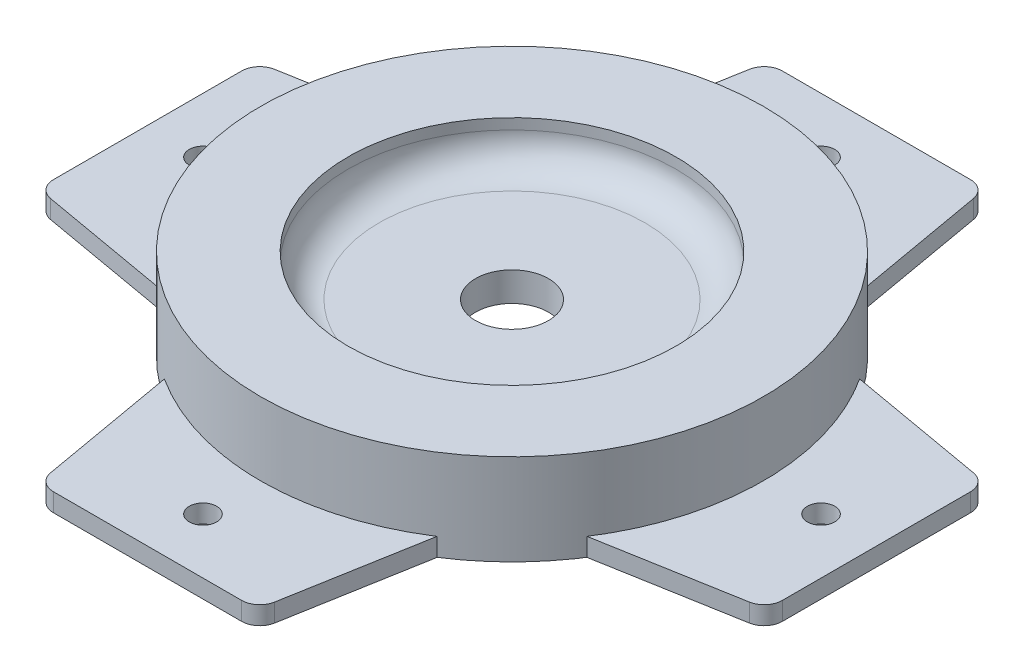
from build123d import *

# Parameters (mm, degrees)
F_1_1_DIAMETER_HOLE1_D = 25.4
BOSS_EXTRUDE1_DEPTH    = 6.35
FILLET2_R              = 6.35
CIRPATTERN4_COUNT      = 4
FILLET3_R              = 10.795


with BuildPart() as part:
    # Sketch1 → Revolve1 (revolve)
    with BuildSketch(Plane.XY, mode=Mode.PRIVATE) as revolve1_sk:
        Polygon((87.63, -7.0866), (87.63, 24.6634), (57.15, 24.6634), (57.15, 10.16), (0, 10.16), (0, 0), (57.15, 0), (57.15, -7.0866), align=None)
    revolve(revolve1_sk.sketch.rotate(Axis((0, 92.596818824, 0), (0, -1, 0)), 90), axis=Axis((0, 92.596818824, 0), (0, -1, 0)))

    # 1 (1) Diameter Hole1 (through all)
    with Locations(Plane(origin=(0, 10.16, 0), x_dir=(1, 0, 0), z_dir=(0, 1, 0))):
        with Locations((0, 0)):
            Hole(F_1_1_DIAMETER_HOLE1_D / 2)

    # Fillet3
    # the kernel refuses this fillet: 10.795 mm, written as the material it adds along each edge
    with BuildSketch(Plane(origin=(0, 0, 0), x_dir=(0, 0, 1), z_dir=(1, 0, 0))) as fillet3_piece_1:
        with BuildLine():
            CenterArc((47.011962989, 10.795), FILLET3_R, 270, 69.907948581)
            Line((47.011962989, 0), (47.011962989, -0.2159))
            Line((47.011962989, -0.2159), (57.15, -0.2159))
            Line((57.15, -0.2159), (57.3659, 0))
            ThreePointArc((57.3659, 0), (57.3659, 3.5433), (57.35276074, 7.012432))
            Line((57.35276074, 7.012432), (57.15, 7.0866))
        make_face()
    revolve(axis=Axis((0, 0, 0), (0, -1, 0)))
    with BuildSketch(Plane(origin=(0, 10.16, 0), x_dir=(0, 0, 1), z_dir=(1, 0, 0))) as fillet3_piece_2:
        with BuildLine():
            CenterArc((57.15 - FILLET3_R, -FILLET3_R), FILLET3_R, 0, 90)
            Line((57.15 - FILLET3_R, 0), (57.15 - FILLET3_R, FILLET3_R * 0.02))
            Line((57.15 - FILLET3_R, FILLET3_R * 0.02), (57.15 + FILLET3_R * 0.02, FILLET3_R * 0.02))
            Line((57.15 + FILLET3_R * 0.02, FILLET3_R * 0.02), (57.15 + FILLET3_R * 0.02, -FILLET3_R))
            Line((57.15 + FILLET3_R * 0.02, -FILLET3_R), (57.15, -FILLET3_R))
        make_face()
    revolve(axis=Axis((0, 10.16, 0), (0, -1, 0)))


with BuildPart() as body_2:
    # Sketch15 → Boss-Extrude1 (new body)
    with BuildSketch(Plane.XZ.offset(7.0866)):
        with BuildLine():
            Line((-127, -38.1), (-73.632954963, -47.510049921))
            ThreePointArc((-73.632954963, -47.510049921), (-87.63, 0), (-73.632954963, 47.510049921))
            Line((-73.632954963, 47.510049921), (-127, 38.1))
            Line((-127, 38.1), (-127, -38.1))
        make_face()
    extrude(amount=-BOSS_EXTRUDE1_DEPTH)

    # Fillet2
    fillet2_edges = [body_2.edges().sort_by_distance(p)[0] for p in [
        (-127, -3.9116, 38.1),
        (-127, -3.9116, -38.1),
    ]]
    fillet(fillet2_edges, radius=FILLET2_R)

    # Sketch17 → 3/8 (0.375) Diameter Hole1 (revolve, cut)
    with BuildSketch(Plane(origin=(-107.696, -0.7366, 0), x_dir=(0, 0, 1), z_dir=(1, 0, 0))):
        Polygon((0, 0), (0, 28.261598698), (4.7625, 25.4), (4.7625, 0), align=None)
    revolve(axis=Axis((-107.696, 5.6134, 0), (0, -1, 0)), mode=Mode.SUBTRACT)


with BuildPart() as cirpattern4_1:
    # CirPattern4: pattern copy
    add(body_2.part.rotate(Axis((0, 0, 0), (0, 1, 0)), 1 * 360 / CIRPATTERN4_COUNT))


with BuildPart() as cirpattern4_2:
    # CirPattern4: pattern copy
    add(body_2.part.rotate(Axis((0, 0, 0), (0, 1, 0)), 2 * 360 / CIRPATTERN4_COUNT))


with BuildPart() as cirpattern4_3:
    # CirPattern4: pattern copy
    add(body_2.part.rotate(Axis((0, 0, 0), (0, 1, 0)), 3 * 360 / CIRPATTERN4_COUNT))


solid = Compound([part.part, body_2.part, cirpattern4_1.part, cirpattern4_2.part, cirpattern4_3.part])
